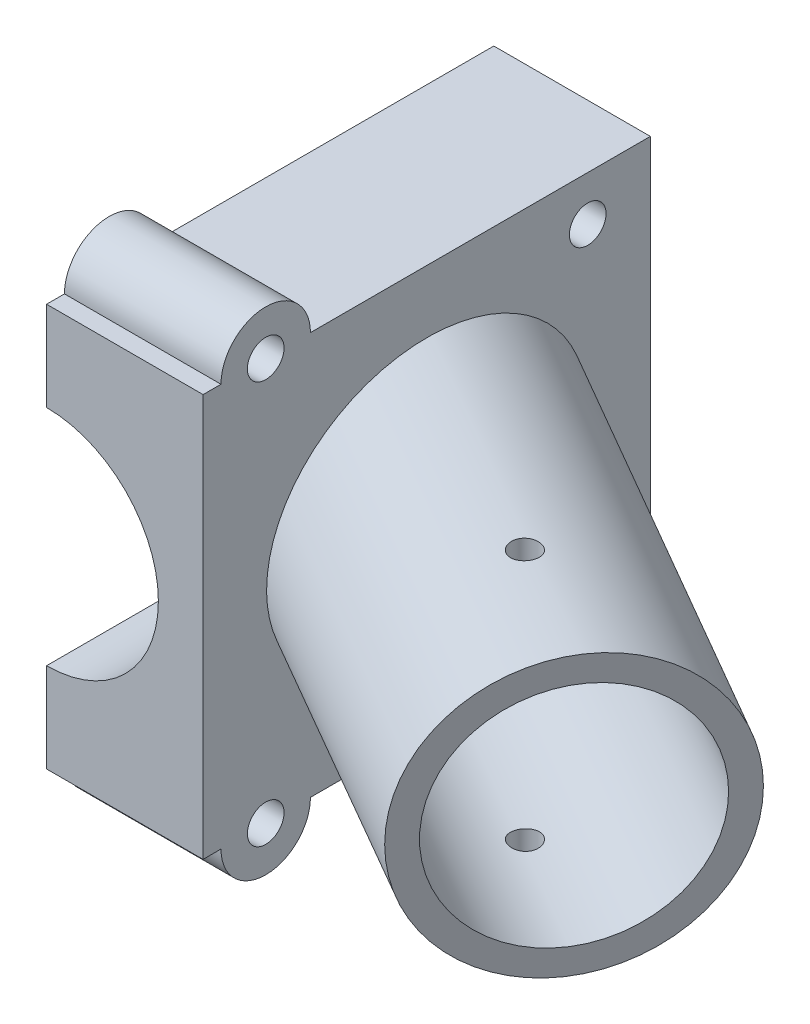
from build123d import *
from build123d.topology import SkipClean

# Parameters (mm, degrees)
BOSS_EXTRUDE1_DEPTH             = 25
BOSS_EXTRUDE2_REACH             = 65.362
BOSS_EXTRUDE2_DIRECTION_2_DEPTH = 30
SKETCH9_R                       = 2.05
CUT_EXTRUDE3_DEPTH              = 35
BOSS_EXTRUDE5_REACH             = 62.896
SKETCH13_R                      = 1.55
CUT_EXTRUDE4_DEPTH              = 87.254538717
SKETCH16_W                      = 50
SKETCH16_H                      = 45
CUT_EXTRUDE5_DEPTH              = 17.5
BOSS_EXTRUDE6_DEPTH             = 17.5
SKETCH20_R                      = 2.05
CUT_EXTRUDE6_DEPTH              = 17.5


with BuildPart() as part:
    # Sketch1 → Boss-Extrude1 (new, symmetric)
    with BuildSketch(Plane.XY):
        with BuildLine():
            Line((-17.5, 22.5), (-17.5, 0))
            Line((-17.5, 0), (17.5, 0))
            Line((17.5, 0), (17.5, 22.5))
            Line((17.5, 22.5), (12.5, 22.5))
            ThreePointArc((12.5, 22.5), (0, 10), (-12.5, 22.5))
            Line((-12.5, 22.5), (-17.5, 22.5))
        make_face()
    boss_extrude1 = extrude(amount=BOSS_EXTRUDE1_DEPTH, both=True)

    # Boss-Extrude2: up to this face of the body (flat: up to its plane)
    boss_extrude2_end = Plane(part.part.faces().sort_by_distance((17.5, 11.25, 0))[0])
    # Sketch5 → Boss-Extrude2 (add, up to the picked face)
    with BuildSketch(Plane(origin=(26.115381057, 0, 15.077722283), x_dir=(0.500000000000001, 0, -0.8660254037844382), z_dir=(0.8660254037844382, 0, 0.500000000000001)), mode=Mode.PRIVATE) as boss_extrude2_sk1:
        with BuildLine():
            Line((-6.75, 22.5), (-3.9, 22.5))
            ThreePointArc((-3.9, 22.5), (8.75, 9.85), (21.4, 22.5))
            Line((21.4, 22.5), (24.25, 22.5))
            ThreePointArc((24.25, 22.5), (8.75, 7), (-6.75, 22.5))
        make_face()
    boss_extrude2_tool1 = split(extrude(boss_extrude2_sk1.sketch, amount=-BOSS_EXTRUDE2_REACH, mode=Mode.PRIVATE), bisect_by=boss_extrude2_end, keep=Keep.BOTH, mode=Mode.PRIVATE)
    boss_extrude2 = boss_extrude2_tool1.solids().sort_by(Axis((23.452881, 22.153409, 19.689308), (-0.8660254037844382, 0, -0.500000000000001)))[0]
    add(boss_extrude2)

    # Sketch5 → Boss-Extrude2 direction 2 (add)
    with BuildSketch(Plane(origin=(26.115381057, 0, 15.077722283), x_dir=(0.500000000000001, 0, -0.8660254037844382), z_dir=(0.8660254037844382, 0, 0.500000000000001))):
        with BuildLine():
            Line((-6.75, 22.5), (-3.9, 22.5))
            ThreePointArc((-3.9, 22.5), (8.75, 9.85), (21.4, 22.5))
            Line((21.4, 22.5), (24.25, 22.5))
            ThreePointArc((24.25, 22.5), (8.75, 7), (-6.75, 22.5))
        make_face()
    boss_extrude2_direction_2 = extrude(amount=BOSS_EXTRUDE2_DIRECTION_2_DEPTH)

    # Sketch9 → Cut-Extrude3 (cut)
    with BuildSketch(Plane.ZY.offset(17.5)):
        with Locations((-18, 5)):
            Circle(SKETCH9_R)
    cut_extrude3 = extrude(amount=-CUT_EXTRUDE3_DEPTH, mode=Mode.SUBTRACT)

    # Boss-Extrude5: up to this face of the body (flat: up to its plane)
    boss_extrude5_end = Plane(part.part.faces().sort_by_distance((17.5, 17.131173253, 0))[0])
    # Sketch12 → Boss-Extrude5 (add, up to the picked face)
    with BuildSketch(Plane(origin=(22.048076211, 0, 12.729462736), x_dir=(0.4999999999999999, 0, -0.8660254037844388), z_dir=(0.8660254037844388, 0, 0.4999999999999999)), mode=Mode.PRIVATE) as boss_extrude5_sk1:
        with BuildLine():
            Line((-3.9, 22.5), (21.4, 22.5))
            ThreePointArc((21.4, 22.5), (8.75, 9.85), (-3.9, 22.5))
        make_face()
    boss_extrude5_tool1 = split(extrude(boss_extrude5_sk1.sketch, amount=-BOSS_EXTRUDE5_REACH, mode=Mode.PRIVATE), bisect_by=boss_extrude5_end, keep=Keep.BOTH, mode=Mode.PRIVATE)
    boss_extrude5 = boss_extrude5_tool1.solids().sort_by(Axis((26.423076, 17.131173, 5.15174), (-0.8660254037844388, 0, -0.4999999999999999)))[0]
    add(boss_extrude5)

    # Mirror1: Boss-Extrude1, Boss-Extrude2, Boss-Extrude2 direction 2, Cut-Extrude3, Boss-Extrude5 across plane
    with SkipClean():  # the faces are left unmerged after this step: merging them gives an invalid solid
        add(boss_extrude1.mirror(Plane(origin=(17.5, 22.5, 25), x_dir=(0, 0, 1), z_dir=(0, -1, 0))))
        add(boss_extrude2.mirror(Plane(origin=(17.5, 22.5, 25), x_dir=(0, 0, 1), z_dir=(0, -1, 0))))
        add(boss_extrude2_direction_2.mirror(Plane(origin=(17.5, 22.5, 25), x_dir=(0, 0, 1), z_dir=(0, -1, 0))))
        add(cut_extrude3.mirror(Plane(origin=(17.5, 22.5, 25), x_dir=(0, 0, 1), z_dir=(0, -1, 0))), mode=Mode.SUBTRACT)
        add(boss_extrude5.mirror(Plane(origin=(17.5, 22.5, 25), x_dir=(0, 0, 1), z_dir=(0, -1, 0))))

    # Sketch13 → Cut-Extrude4 (cut, through all)
    with SkipClean():  # the faces are left unmerged after this step: merging them gives an invalid solid
        with BuildSketch(Plane(origin=(0, 0, 0), x_dir=(1, 0, 0), z_dir=(0, 1, 0))):
            with Locations(Location((43.480762114, -15, 0), (0, 0, 90))):
                Circle(SKETCH13_R)
        extrude(amount=CUT_EXTRUDE4_DEPTH, mode=Mode.SUBTRACT)

    # Sketch16 → Cut-Extrude5 (cut)
    with SkipClean():  # the faces are left unmerged after this step: merging them gives an invalid solid
        with BuildSketch(Plane(origin=(0, 0, 0), x_dir=(0, 0, -1), z_dir=(1, 0, 0))):
            with Locations((0, 22.5)):
                Rectangle(SKETCH16_W, SKETCH16_H)
        extrude(amount=-CUT_EXTRUDE5_DEPTH, mode=Mode.SUBTRACT)
    add(part.part.scale(1), mode=Mode.REPLACE)  # the faces are merged on a copy

    # Sketch18 → Boss-Extrude6 (add)
    with BuildSketch(Plane.ZY):
        with BuildLine():
            Line((13, 0), (23, 0))
            ThreePointArc((23, 0), (18, -5), (13, 0))
        make_face()
    boss_extrude6 = extrude(amount=-BOSS_EXTRUDE6_DEPTH)

    # Sketch20 → Cut-Extrude6 (cut)
    with BuildSketch(Plane.ZY):
        with Locations((18, 0)):
            Circle(SKETCH20_R)
    cut_extrude6 = extrude(amount=-CUT_EXTRUDE6_DEPTH, mode=Mode.SUBTRACT)

    # Mirror2: Boss-Extrude6, Cut-Extrude6 across plane
    add(boss_extrude6.mirror(Plane.ZX.offset(22.5)))
    add(cut_extrude6.mirror(Plane.ZX.offset(22.5)), mode=Mode.SUBTRACT)


solid = part.part
